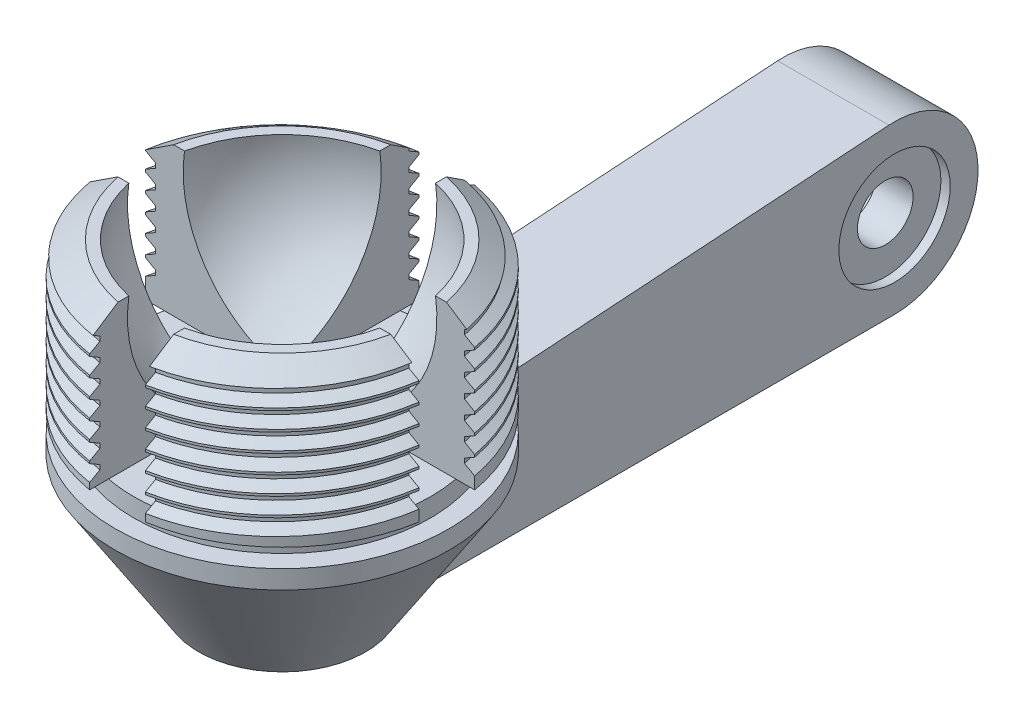
from build123d import *

# Parameters (mm, degrees)
CUT_EXTRUDE1_DEPTH      = 21.4450483
CUT_EXTRUDE1_DEPTH_BACK = 21.4450483
SKETCH2_W               = 18
SKETCH2_H               = 8
CUT_EXTRUDE8_DEPTH      = 8
THREAD3_PITCH           = 1
BOSS_EXTRUDE1_DEPTH     = 3
SKETCH24_R              = 3
CUT_EXTRUDE9_DEPTH      = 3.5
CUT_EXTRUDE10_START     = -0.5
SKETCH25_R              = 3
CUT_EXTRUDE10_DEPTH     = 0.5
SKETCH26_R              = 1.5
CUT_EXTRUDE11_DEPTH     = 40.73034108
SKETCH27_W              = 1
SKETCH27_H              = 1


with BuildPart() as part:
    # Sketch1 → Revolve1 (revolve)
    with BuildSketch(Plane.XY, mode=Mode.PRIVATE) as revolve1_sk:
        with BuildLine():
            Line((0, 9), (0, 7))
            ThreePointArc((0, 7), (7, 0), (0, -7))
            Line((0, -7), (0, -16))
            Line((0, -16), (4.5, -16))
            Line((4.5, -16), (9, -9))
            Line((9, -9), (9, 9))
            Line((9, 9), (0, 9))
        make_face()
    revolve(revolve1_sk.sketch.rotate(Axis((0, 9, 0), (0, -1, 0)), 180), axis=Axis((0, 9, 0), (0, -1, 0)))

    # Sketch2 → Cut-Extrude1 (cut, two sides: drawn at the far end of the back side and taken through both)
    with BuildSketch(Plane.XY.offset(-CUT_EXTRUDE1_DEPTH_BACK)):
        with Locations((0, 5)):
            Rectangle(SKETCH2_W, SKETCH2_H)
    extrude(amount=CUT_EXTRUDE1_DEPTH + CUT_EXTRUDE1_DEPTH_BACK, mode=Mode.SUBTRACT)

    # Sketch18 → Cut-Extrude8 (cut)
    with BuildSketch(Plane(origin=(0, 1, 0), x_dir=(1, 0, 0), z_dir=(0, 1, 0))):
        Polygon((1.5, 1.5), (9, 1.5), (9, -1.5), (1.5, -1.5), (1.5, -9), (-1.5, -9), (-1.5, -1.5), (-9, -1.5), (-9, 1.5), (-1.5, 1.5), (-1.5, 9), (1.5, 9), align=None)
    extrude(amount=-CUT_EXTRUDE8_DEPTH, mode=Mode.SUBTRACT)

    # Thread3: the profile of Thread Profile4 profile screwed along a right-hand helix of 7 turns, 8 arcs to a turn; built about Z, then put on its axis
    thread3_z = Axis((0, 0, 0), (0, 0, 1))
    thread3_corners = [(9.0003, 0, -0.000173205), (9.0003, 0, 0.875173202), (8.458734125, 0, 0.562499999), (8.458734125, 0, 0.312499999)]
    with BuildLine(mode=Mode.PRIVATE) as thread3_profile:
        Line(thread3_corners[0], thread3_corners[1])
        Line(thread3_corners[1], thread3_corners[2])
        Line(thread3_corners[2], thread3_corners[3])
        Line(thread3_corners[3], thread3_corners[0])
    thread3_cap = Face(thread3_profile.wire())
    thread3_turn_angles = [0, 22.5, 45, 67.5, 90, 112.5, 135, 157.5, 180, 202.5, 225, 247.5, 270, 292.5, 315, 337.5, 360]
    thread3_turn_weights = [1, 0.9238795325112867, 1, 0.9238795325112867, 1, 0.9238795325112867, 1, 0.9238795325112867, 1, 0.9238795325112867, 1, 0.9238795325112867, 1, 0.9238795325112867, 1, 0.9238795325112867, 1]
    thread3_turn_rails = [Edge.make_bspline([Vector(p[0], p[1], 0).rotate(thread3_z, thread3_turn_angles[k]) / thread3_turn_weights[k] + Vector(0, 0, p[2] + THREAD3_PITCH * thread3_turn_angles[k] / 360) for k in range(17)], [0, 0, 0, 1, 1, 2, 2, 3, 3, 4, 4, 5, 5, 6, 6, 7, 7, 8, 8, 8], 2, thread3_turn_weights) for p in thread3_corners]
    thread3_turn_sides = [Face.make_surface_from_curves(thread3_turn_rails[p[0]], thread3_turn_rails[p[1]]) for p in [(0, 1), (1, 2), (2, 3), (3, 0)]]
    thread3 = Plane(origin=(0, 1, 0), x_dir=(-1, 0, 0), z_dir=(0, -1, 0)) * Solid(Shell([*[p.moved(Location((0, 0, THREAD3_PITCH * i))) for i in range(7) for p in thread3_turn_sides], thread3_cap, thread3_cap.rotate(thread3_z, 2520).moved(Location((0, 0, THREAD3_PITCH * 2520 / 360)))]))
    add(thread3, mode=Mode.SUBTRACT)

    # Sketch23 → Boss-Extrude1 (add, symmetric)
    with BuildSketch(Plane(origin=(0, 0, 0), x_dir=(0, 0, -1), z_dir=(1, 0, 0))):
        with BuildLine():
            Line((29.700332963, -7.009988901), (-0.233074362, -9.007769145))
            ThreePointArc((-0.233074362, -9.007769145), (-3.498057174, -12.616601906), (0, -16))
            Line((0, -16), (30, -16))
            ThreePointArc((30, -16), (34.497502081, -11.350083264), (29.700332963, -7.009988901))
        make_face()
    extrude(amount=BOSS_EXTRUDE1_DEPTH, both=True)

    # Sketch24 → Cut-Extrude9 (cut)
    with BuildSketch(Plane.ZY.offset(3)):
        with Locations((-30, -11.5)):
            Circle(SKETCH24_R)
    extrude(amount=-CUT_EXTRUDE9_DEPTH, mode=Mode.SUBTRACT)

    # Sketch25 → Cut-Extrude10 (cut)
    with BuildSketch(Plane(origin=(3, 0, 0), x_dir=(0, 0, -1), z_dir=(1, 0, 0)).offset(CUT_EXTRUDE10_START)):
        with Locations(Location((30, -11.5, 0), (0, 0, 180))):
            Circle(SKETCH25_R)
    extrude(amount=CUT_EXTRUDE10_DEPTH, mode=Mode.SUBTRACT)

    # Sketch26 → Cut-Extrude11 (cut, through all)
    with BuildSketch(Plane(origin=(2.5, 0, 0), x_dir=(0, 0, -1), z_dir=(1, 0, 0))):
        with Locations((30, -11.5)):
            Circle(SKETCH26_R)
    extrude(amount=-CUT_EXTRUDE11_DEPTH, mode=Mode.SUBTRACT)

    # Sketch27 → Cut-Revolve1 (revolve, cut)
    with BuildSketch(Plane(origin=(0, 0, 0), x_dir=(0, 0, -1), z_dir=(1, 0, 0)), mode=Mode.PRIVATE) as cut_revolve1_sk:
        Polygon((7.5, 1), (9, 1), (9, 0), align=None)
        with Locations((8.5, -7.5)):
            Rectangle(SKETCH27_W, SKETCH27_H)
    revolve(cut_revolve1_sk.sketch.rotate(Axis((0, 0, 0), (0, -1, 0)), 340.528779366), axis=Axis((0, 0, 0), (0, -1, 0)), mode=Mode.SUBTRACT)


solid = part.part
